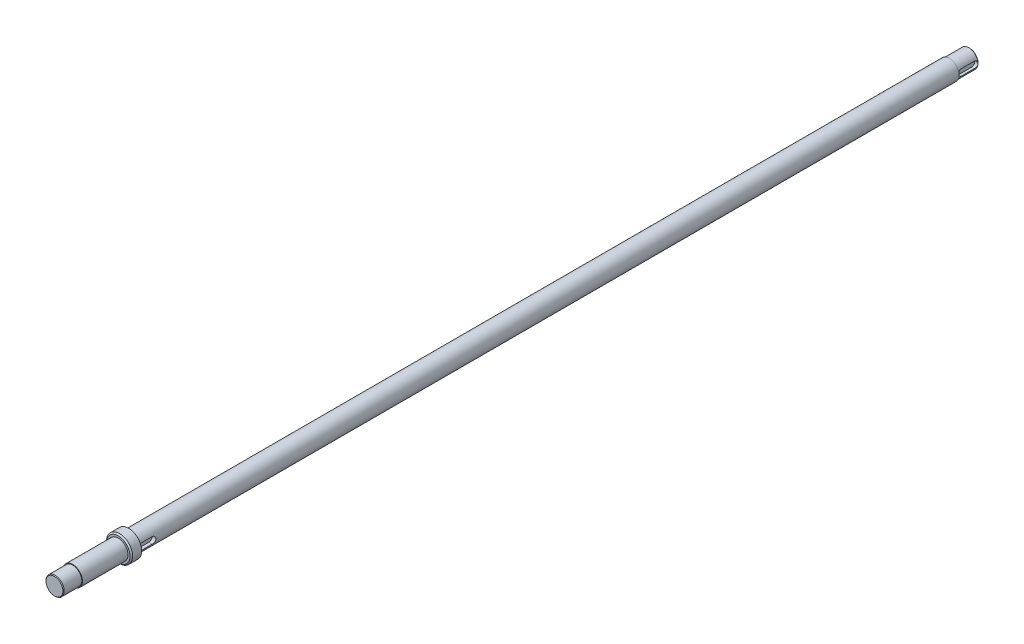
from build123d import *

# Parameters (mm, degrees)
CUT_EXTRUDE_1_DEPTH = 704.220626831
CHAMFER_1_SIZE      = 1
SKETCH_3_R          = 3
CUT_EXTRUDE_2_DEPTH = 15
CHAMFER_2_SIZE      = 0.5


with BuildPart() as part:
    # 草图1 → 旋转1 (revolve)
    with BuildSketch(Plane(origin=(0, 0, 0), x_dir=(0, 0, -1), z_dir=(1, 0, 0)), mode=Mode.PRIVATE) as revolve_1_sk:
        Polygon((0, 0), (0, 7), (14, 7), (14, 7.5), (49, 7.5), (49, 10), (57, 10), (57, 7.5), (687.5, 7.5), (687.5, 7), (703, 7), (703, 0), align=None)
    revolve(revolve_1_sk.sketch.rotate(Axis((0, 0, 0), (0, 0, 1)), 90), axis=Axis((0, 0, 0), (0, 0, 1)))

    # 草图2 → 切除-拉伸1 (cut, through all)
    with BuildSketch(Plane(origin=(4.5, 0, 0), x_dir=(0, 0, -1), z_dir=(1, 0, 0))):
        with BuildLine():
            Line((60, 2.5), (68, 2.5))
            ThreePointArc((68, 2.5), (70.5, 0), (68, -2.5))
            Line((68, -2.5), (60, -2.5))
            ThreePointArc((60, -2.5), (57.5, 0), (60, 2.5))
        make_face()
        with BuildLine():
            Line((690, 2.5), (700, 2.5))
            ThreePointArc((700, 2.5), (702.5, 0), (700, -2.5))
            Line((700, -2.5), (690, -2.5))
            ThreePointArc((690, -2.5), (687.5, 0), (690, 2.5))
        make_face()
    extrude(amount=CUT_EXTRUDE_1_DEPTH, mode=Mode.SUBTRACT)

    # 倒角1
    chamfer_1_edges = [part.edges().sort_by_distance(p)[0] for p in [
        (10, 0, -49),
    ]]
    chamfer(chamfer_1_edges, length=CHAMFER_1_SIZE)

    # 草图3 → 切除-拉伸2 (cut)
    with BuildSketch(Plane(origin=(0, 0, -703), x_dir=(-1, 0, 0), z_dir=(0, 0, -1))):
        Circle(SKETCH_3_R)
    extrude(amount=-CUT_EXTRUDE_2_DEPTH, mode=Mode.SUBTRACT)

    # 倒角2
    chamfer_2_edges = [part.edges().sort_by_distance(p)[0] for p in [
        (7, 0, 0),
        (3, 0, -703),
        (7, 0, -703),
    ]]
    chamfer(chamfer_2_edges, length=CHAMFER_2_SIZE - 0.0001)  # a hair under: the kernel refuses the full size


solid = part.part
